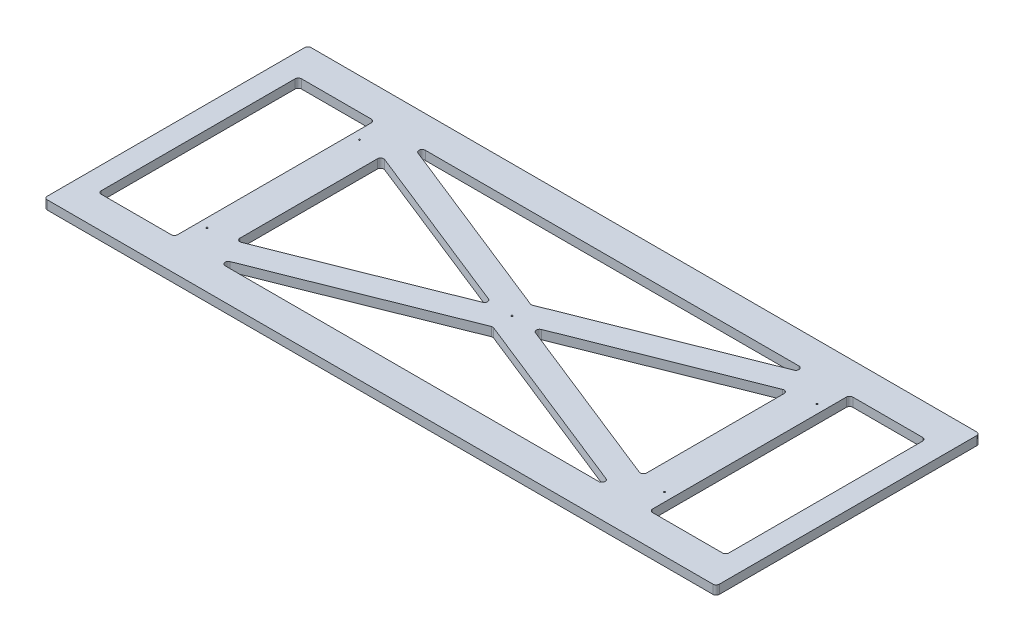
from build123d import *

# Parameters (mm, degrees)
SKETCH1_W                    = 1343.025
SKETCH1_H                    = 527.05
BOSS_EXTRUDE1_DEPTH          = 17.78
FILLET1_R                    = 6.35
F_1_8_0_125_DIAMETER_HOLE1_D = 3.175
SKETCH5_W                    = 152.4
SKETCH5_H                    = 400.05
CUT_EXTRUDE1_DEPTH           = 722.588935393
FILLET2_R                    = 6.35


with BuildPart() as part:
    # Sketch1 → Boss-Extrude1 (new body)
    with BuildSketch(Plane(origin=(0, 0, 0), x_dir=(1, 0, 0), z_dir=(0, 1, 0))):
        Rectangle(SKETCH1_W, SKETCH1_H)
    extrude(amount=BOSS_EXTRUDE1_DEPTH)

    # Fillet1
    fillet1_edges = [part.edges().sort_by_distance(p)[0] for p in [
        (-671.5125, 8.89, 263.525),
        (-671.5125, 8.89, -263.525),
        (671.5125, 8.89, -263.525),
        (671.5125, 8.89, 263.525),
    ]]
    fillet(fillet1_edges, radius=FILLET1_R)

    # 1/8 (0.125) Diameter Hole1 (through all)
    with Locations(Plane(origin=(0, 17.78, 0), x_dir=(1, 0, 0), z_dir=(0, 1, 0))):
        with Locations((0, 0), (457.2, 152.4), (-457.2, -152.4), (-457.2, 152.4), (457.2, -152.4)):
            Hole(F_1_8_0_125_DIAMETER_HOLE1_D / 2)

    # Sketch5 → Cut-Extrude1 (cut, through all)
    with BuildSketch(Plane(origin=(0, 17.78, 0), x_dir=(1, 0, 0), z_dir=(0, 1, 0))):
        Polygon((-406.4, 200.025), (406.4, 200.025), (0, 38.1), align=None)
        Polygon((0, -38.1), (-406.4, -200.025), (406.4, -200.025), align=None)
        Polygon((406.4, 146.74453125), (406.4, -146.74453125), (38.1, 0), align=None)
        Polygon((-406.4, 146.74453125), (-38.1, 0), (-406.4, -146.74453125), align=None)
        with Locations((550.8625, 0)):
            Rectangle(SKETCH5_W, SKETCH5_H)
        with Locations((-550.8625, 0)):
            Rectangle(SKETCH5_W, SKETCH5_H)
    extrude(amount=-CUT_EXTRUDE1_DEPTH, mode=Mode.SUBTRACT)

    # Fillet2
    fillet2_edges = [part.edges().sort_by_distance(p)[0] for p in [
        (474.6625, 8.89, -200.025),
        (474.6625, 8.89, 200.025),
        (627.0625, 8.89, 200.025),
        (406.4, 8.89, 146.74453125),
        (406.4, 8.89, 200.025),
        (627.0625, 8.89, -200.025),
        (406.4, 8.89, -146.74453125),
        (406.4, 8.89, -200.025),
        (38.1, 8.89, 0),
        (0, 8.89, 38.1),
        (0, 8.89, -38.1),
        (-38.1, 8.89, 0),
        (-406.4, 8.89, 200.025),
        (-406.4, 8.89, -200.025),
        (-406.4, 8.89, -146.74453125),
        (-406.4, 8.89, 146.74453125),
        (-627.0625, 8.89, 200.025),
        (-474.6625, 8.89, 200.025),
        (-474.6625, 8.89, -200.025),
        (-627.0625, 8.89, -200.025),
    ]]
    fillet(fillet2_edges, radius=FILLET2_R)


solid = part.part
